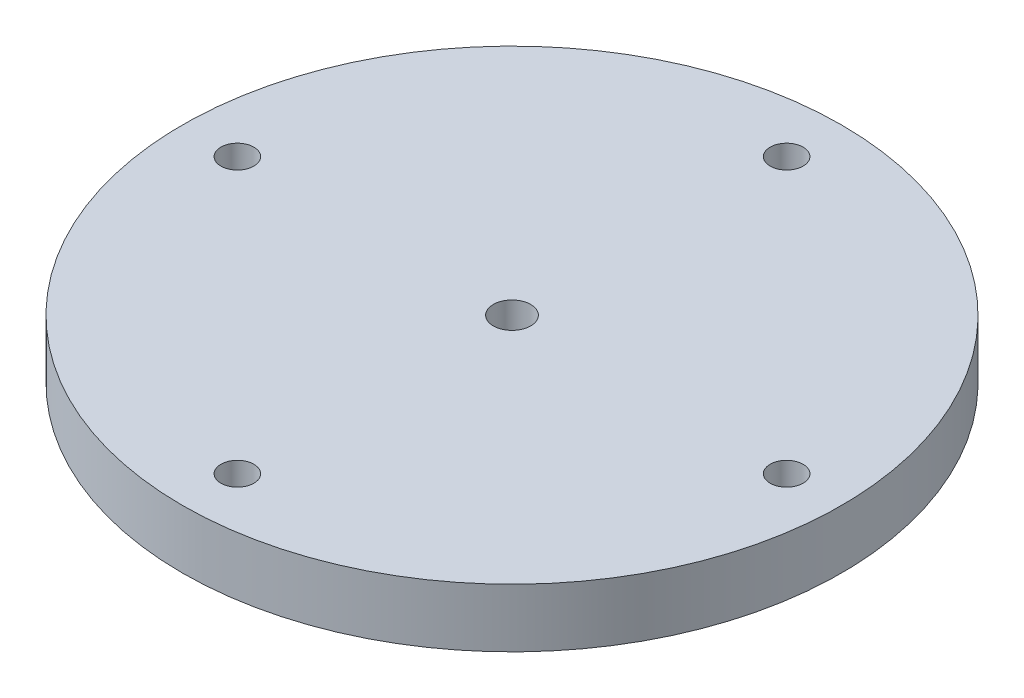
from build123d import *

# Parameters (mm, degrees)
SKETCH1_R           = 45
BOSS_EXTRUDE1_DEPTH = 8
SKETCH2_R           = 2.25
CUT_EXTRUDE1_DEPTH  = 65.140470843
SKETCH3_R           = 2.55
CUT_EXTRUDE2_DEPTH  = 8


with BuildPart() as part:
    # Sketch1 → Boss-Extrude1 (new body)
    with BuildSketch(Plane(origin=(0, 0, 0), x_dir=(1, 0, 0), z_dir=(0, 1, 0))):
        Circle(SKETCH1_R)
    extrude(amount=BOSS_EXTRUDE1_DEPTH)

    # Sketch2 → Cut-Extrude1 (cut, through all)
    with BuildSketch(Plane(origin=(0, 8, 0), x_dir=(1, 0, 0), z_dir=(0, 1, 0))):
        with Locations((0, 37.5)):
            Circle(SKETCH2_R)
        with Locations((-37.5, 0)):
            Circle(SKETCH2_R)
        with Locations((0, -37.5)):
            Circle(SKETCH2_R)
        with Locations((37.5, 0)):
            Circle(SKETCH2_R)
    extrude(amount=-CUT_EXTRUDE1_DEPTH, mode=Mode.SUBTRACT)

    # Sketch3 → Cut-Extrude2 (cut)
    with BuildSketch(Plane(origin=(0, 8, 0), x_dir=(1, 0, 0), z_dir=(0, 1, 0))):
        Circle(SKETCH3_R)
    extrude(amount=-CUT_EXTRUDE2_DEPTH, mode=Mode.SUBTRACT)


solid = part.part
